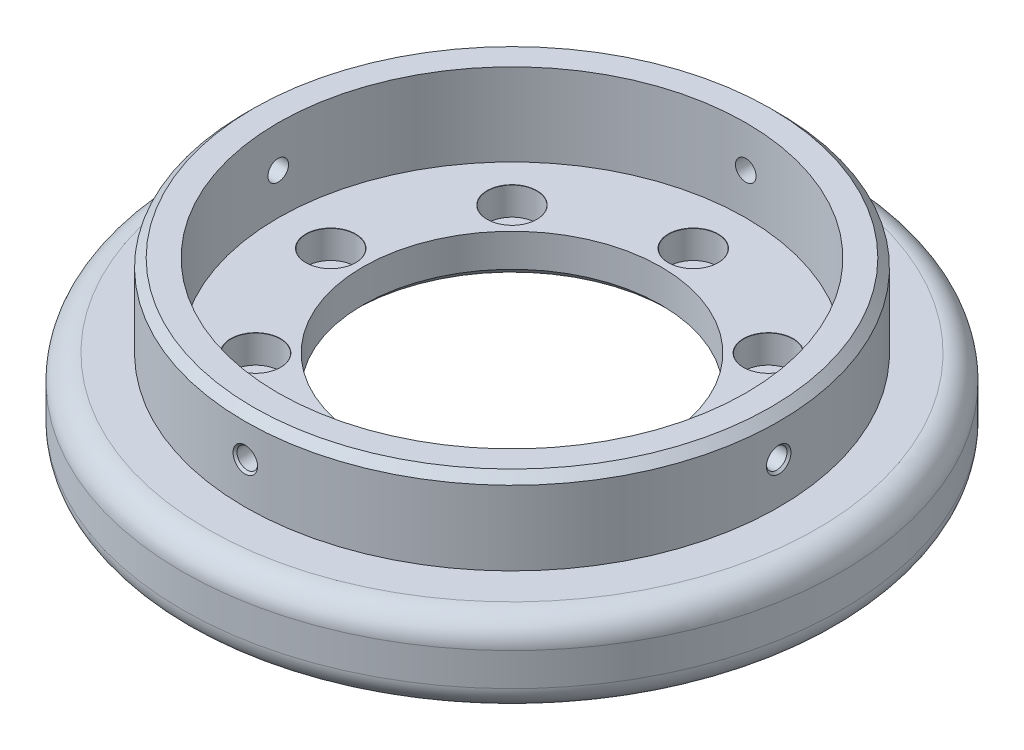
from build123d import *

# Parameters (mm, degrees)
SKETCH_1_R               = 40
EXTRUDE_1_DEPTH          = 10
SKETCH_2_R               = 27.25
CUT_EXTRUDE_1_DEPTH      = 5
SKETCH_4_R               = 32.4
SKETCH_4_R_2             = 28.4
EXTRUDE_2_DEPTH          = 10
SKETCH_5_R               = 18.1
CUT_EXTRUDE_2_DEPTH      = 58.445626465
PATTERN_CIRCULAR_1_COUNT = 8
PATTERN_CIRCULAR_2_COUNT = 4
CHAMFER_1_SIZE           = 1
CHAMFER_2_SIZE           = 1
FILLET_1_R               = 3
CHAMFER_3_SIZE           = 1


# Read off the part's stored shape, not the designer's step: M3 螺纹孔1
with BuildPart() as part:
    # 草图1 → 凸台-拉伸1 (new body)
    with BuildSketch(Plane(origin=(0, 0, 0), x_dir=(1, 0, 0), z_dir=(0, 1, 0))):
        with Locations(Location((0, 0, 0), (0, 0, 270))):
            Circle(SKETCH_1_R)
    extrude(amount=EXTRUDE_1_DEPTH)

    # 草图2 → 切除-拉伸1 (cut)
    with BuildSketch(Plane.XZ):
        with Locations(Location((0, 0, 0), (0, 0, 270))):
            Circle(SKETCH_2_R)
    extrude(amount=-CUT_EXTRUDE_1_DEPTH, mode=Mode.SUBTRACT)

    # 草图4 → 凸台-拉伸2 (add)
    with BuildSketch(Plane(origin=(0, 10, 0), x_dir=(1, 0, 0), z_dir=(0, 1, 0))):
        with Locations(Location((0, 0, 0), (0, 0, 270))):
            Circle(SKETCH_4_R)
        with Locations(Location((0, 0, 0), (0, 0, 270))):
            Circle(SKETCH_4_R_2, mode=Mode.SUBTRACT)
    extrude(amount=EXTRUDE_2_DEPTH)

    # 草图5 → 切除-拉伸2 (cut, through all)
    with BuildSketch(Plane(origin=(0, 10, 0), x_dir=(1, 0, 0), z_dir=(0, 1, 0))):
        with Locations(Location((0, 0, 0), (0, 0, 270))):
            Circle(SKETCH_5_R)
    extrude(amount=-CUT_EXTRUDE_2_DEPTH, mode=Mode.SUBTRACT)

    # 草图12 → 打孔尺寸(%根据)内六角圆柱头螺钉的类型3 (revolve, cut)
    with BuildSketch(Plane(origin=(0, 10, -22), x_dir=(0, 0, 1), z_dir=(1, 0, 0))):
        Polygon((0, 0), (0, 10), (1.7, 10), (1.7, 3.4), (3, 3.4), (3, 0.025), (3.025, 0), align=None)
    hole_wizard_3 = revolve(axis=Axis((0, 16.35, -22), (0, -1, 0)), mode=Mode.SUBTRACT)

    # 阵列(圆周)1: 打孔尺寸(%根据)内六角圆柱头螺钉的类型3 ×8 about axis
    pattern_circular_1_axis = Axis((0, 0, 0), (0, 1, 0))
    for i in range(1, PATTERN_CIRCULAR_1_COUNT):
        add(hole_wizard_3.rotate(pattern_circular_1_axis, i * 360 / PATTERN_CIRCULAR_1_COUNT), mode=Mode.SUBTRACT)

    # M3 螺纹孔1 outline → M3 螺纹孔1 (revolve, cut)
    with BuildSketch(Plane(origin=(0, 15, 0), x_dir=(0, 1, 0), z_dir=(0, 0, -1))):
        Polygon((0, -32.400010655), (1.525010655, -32.400010655), (1.25, -32.125), (1.25, -28.372463058), (0, -28.372463058), align=None)
    hole_wizard_m3_1 = revolve(axis=Axis((0, 15, 0), (1, 0, 0)), mode=Mode.SUBTRACT)

    # 阵列(圆周)2: M3 螺纹孔1 ×4 about axis
    pattern_circular_2_axis = Axis((0, 20, 0), (0, -1, 0))
    for i in range(1, PATTERN_CIRCULAR_2_COUNT):
        add(hole_wizard_m3_1.rotate(pattern_circular_2_axis, i * 360 / PATTERN_CIRCULAR_2_COUNT), mode=Mode.SUBTRACT)

    # 倒角1
    chamfer_1_edges = [part.edges().sort_by_distance(p)[0] for p in [
        (0, 20, -32.4),
    ]]
    chamfer(chamfer_1_edges, length=CHAMFER_1_SIZE)

    # 倒角2
    chamfer_2_edges = [part.edges().sort_by_distance(p)[0] for p in [
        (0, 0, 27.25),
    ]]
    chamfer(chamfer_2_edges, length=CHAMFER_2_SIZE)

    # 圆角1
    fillet_1_edges = [part.edges().sort_by_distance(p)[0] for p in [
        (0, 0, -40),
        (0, 10, -40),
    ]]
    fillet(fillet_1_edges, radius=FILLET_1_R)

    # 倒角3
    chamfer_3_edges = [part.edges().sort_by_distance(p)[0] for p in [
        (0, 5, -18.1),
    ]]
    chamfer(chamfer_3_edges, length=CHAMFER_3_SIZE)


solid = part.part
